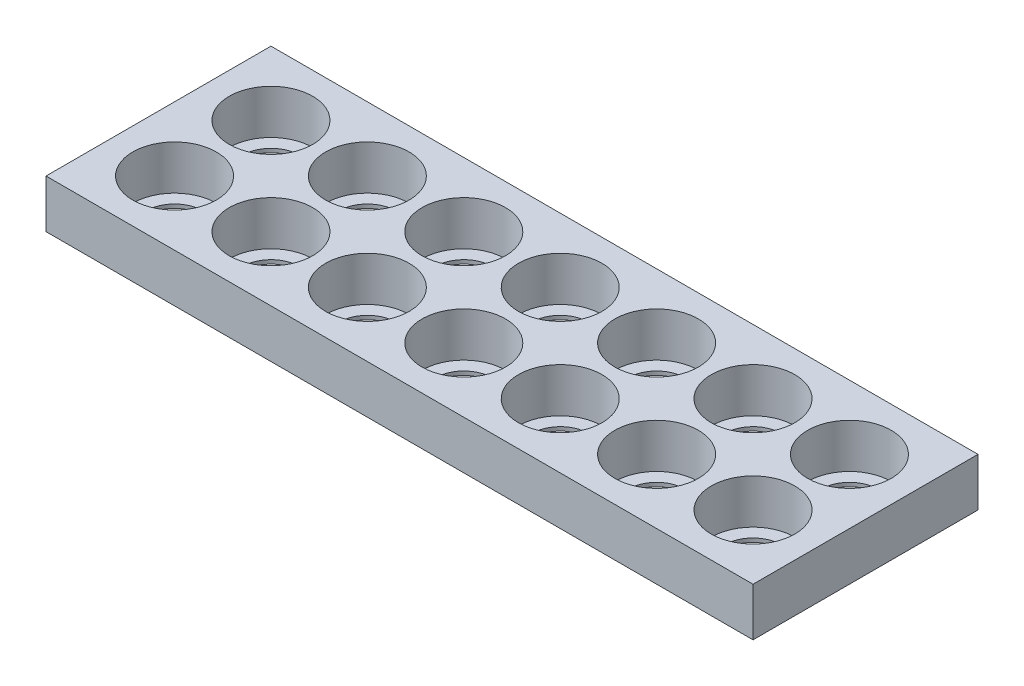
from build123d import *

# Parameters (mm, degrees)
SKETCH1_W           = 186.266666666
SKETCH1_H           = 59.266666666
SKETCH1_R           = 10.9982
BOSS_EXTRUDE2_DEPTH = 12.7
SKETCH1_4_R         = 10.9982
SKETCH1_4_R_2       = 7.5
BOSS_EXTRUDE3_DEPTH = 1.016


with BuildPart() as part:
    # Sketch1 → Boss-Extrude2 (new body)
    with BuildSketch(Plane(origin=(0, 0, 0), x_dir=(1, 0, 0), z_dir=(0, 1, 0))):
        with Locations((76.2, 12.7)):
            Rectangle(SKETCH1_W, SKETCH1_H)
        Circle(SKETCH1_R, mode=Mode.SUBTRACT)
        with Locations((25.4, 0)):
            Circle(SKETCH1_R, mode=Mode.SUBTRACT)
        with Locations((50.8, 0)):
            Circle(SKETCH1_R, mode=Mode.SUBTRACT)
        with Locations((76.2, 0)):
            Circle(SKETCH1_R, mode=Mode.SUBTRACT)
        with Locations((101.6, 0)):
            Circle(SKETCH1_R, mode=Mode.SUBTRACT)
        with Locations((127, 0)):
            Circle(SKETCH1_R, mode=Mode.SUBTRACT)
        with Locations((152.4, 0)):
            Circle(SKETCH1_R, mode=Mode.SUBTRACT)
        with Locations((0, 25.4)):
            Circle(SKETCH1_R, mode=Mode.SUBTRACT)
        with Locations((25.4, 25.4)):
            Circle(SKETCH1_R, mode=Mode.SUBTRACT)
        with Locations((50.8, 25.4)):
            Circle(SKETCH1_R, mode=Mode.SUBTRACT)
        with Locations((76.2, 25.4)):
            Circle(SKETCH1_R, mode=Mode.SUBTRACT)
        with Locations((101.6, 25.4)):
            Circle(SKETCH1_R, mode=Mode.SUBTRACT)
        with Locations((127, 25.4)):
            Circle(SKETCH1_R, mode=Mode.SUBTRACT)
        with Locations((152.4, 25.4)):
            Circle(SKETCH1_R, mode=Mode.SUBTRACT)
    extrude(amount=BOSS_EXTRUDE2_DEPTH)

    # Sketch1<4> → Boss-Extrude3 (add)
    # profile 1 of 14: a face of its own
    with BuildSketch(Plane(origin=(0, 0, 0), x_dir=(1, 0, 0), z_dir=(0, 1, 0))):
        Circle(SKETCH1_4_R)
        Circle(SKETCH1_4_R_2, mode=Mode.SUBTRACT)
    # profile 2 of 14: a face of its own
    with BuildSketch(Plane(origin=(0, 0, 0), x_dir=(1, 0, 0), z_dir=(0, 1, 0))):
        with Locations((25.4, 0)):
            Circle(SKETCH1_4_R)
        with Locations((25.4, 0)):
            Circle(SKETCH1_4_R_2, mode=Mode.SUBTRACT)
    # profile 3 of 14: a face of its own
    with BuildSketch(Plane(origin=(0, 0, 0), x_dir=(1, 0, 0), z_dir=(0, 1, 0))):
        with Locations((50.8, 0)):
            Circle(SKETCH1_4_R)
        with Locations((50.8, 0)):
            Circle(SKETCH1_4_R_2, mode=Mode.SUBTRACT)
    # profile 4 of 14: a face of its own
    with BuildSketch(Plane(origin=(0, 0, 0), x_dir=(1, 0, 0), z_dir=(0, 1, 0))):
        with Locations((76.2, 0)):
            Circle(SKETCH1_4_R)
        with Locations((76.2, 0)):
            Circle(SKETCH1_4_R_2, mode=Mode.SUBTRACT)
    # profile 5 of 14: a face of its own
    with BuildSketch(Plane(origin=(0, 0, 0), x_dir=(1, 0, 0), z_dir=(0, 1, 0))):
        with Locations((101.6, 0)):
            Circle(SKETCH1_4_R)
        with Locations((101.6, 0)):
            Circle(SKETCH1_4_R_2, mode=Mode.SUBTRACT)
    # profile 6 of 14: a face of its own
    with BuildSketch(Plane(origin=(0, 0, 0), x_dir=(1, 0, 0), z_dir=(0, 1, 0))):
        with Locations((127, 0)):
            Circle(SKETCH1_4_R)
        with Locations((127, 0)):
            Circle(SKETCH1_4_R_2, mode=Mode.SUBTRACT)
    # profile 7 of 14: a face of its own
    with BuildSketch(Plane(origin=(0, 0, 0), x_dir=(1, 0, 0), z_dir=(0, 1, 0))):
        with Locations((152.4, 0)):
            Circle(SKETCH1_4_R)
        with Locations((152.4, 0)):
            Circle(SKETCH1_4_R_2, mode=Mode.SUBTRACT)
    # profile 8 of 14: a face of its own
    with BuildSketch(Plane(origin=(0, 0, 0), x_dir=(1, 0, 0), z_dir=(0, 1, 0))):
        with Locations((25.4, 25.4)):
            Circle(SKETCH1_4_R)
        with Locations((25.4, 25.4)):
            Circle(SKETCH1_4_R_2, mode=Mode.SUBTRACT)
    # profile 9 of 14: a face of its own
    with BuildSketch(Plane(origin=(0, 0, 0), x_dir=(1, 0, 0), z_dir=(0, 1, 0))):
        with Locations((50.8, 25.4)):
            Circle(SKETCH1_4_R)
        with Locations((50.8, 25.4)):
            Circle(SKETCH1_4_R_2, mode=Mode.SUBTRACT)
    # profile 10 of 14: a face of its own
    with BuildSketch(Plane(origin=(0, 0, 0), x_dir=(1, 0, 0), z_dir=(0, 1, 0))):
        with Locations((76.2, 25.4)):
            Circle(SKETCH1_4_R)
        with Locations((76.2, 25.4)):
            Circle(SKETCH1_4_R_2, mode=Mode.SUBTRACT)
    # profile 11 of 14: a face of its own
    with BuildSketch(Plane(origin=(0, 0, 0), x_dir=(1, 0, 0), z_dir=(0, 1, 0))):
        with Locations((101.6, 25.4)):
            Circle(SKETCH1_4_R)
        with Locations((101.6, 25.4)):
            Circle(SKETCH1_4_R_2, mode=Mode.SUBTRACT)
    # profile 12 of 14: a face of its own
    with BuildSketch(Plane(origin=(0, 0, 0), x_dir=(1, 0, 0), z_dir=(0, 1, 0))):
        with Locations((127, 25.4)):
            Circle(SKETCH1_4_R)
        with Locations((127, 25.4)):
            Circle(SKETCH1_4_R_2, mode=Mode.SUBTRACT)
    # profile 13 of 14: a face of its own
    with BuildSketch(Plane(origin=(0, 0, 0), x_dir=(1, 0, 0), z_dir=(0, 1, 0))):
        with Locations((152.4, 25.4)):
            Circle(SKETCH1_4_R)
        with Locations((152.4, 25.4)):
            Circle(SKETCH1_4_R_2, mode=Mode.SUBTRACT)
    # profile 14 of 14: a face of its own
    with BuildSketch(Plane(origin=(0, 0, 0), x_dir=(1, 0, 0), z_dir=(0, 1, 0))):
        with Locations((0, 25.4)):
            Circle(SKETCH1_4_R)
        with Locations((0, 25.4)):
            Circle(SKETCH1_4_R_2, mode=Mode.SUBTRACT)
    extrude(amount=BOSS_EXTRUDE3_DEPTH)


solid = part.part
